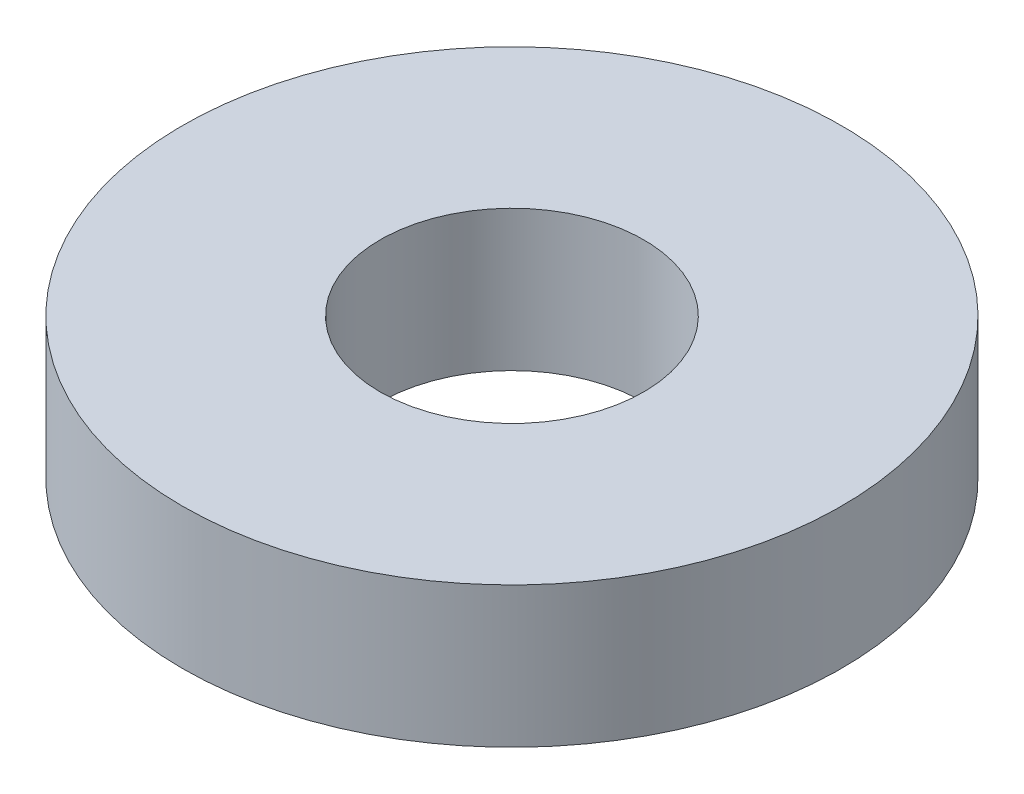
from build123d import *

# Parameters (mm, degrees)
SKETCH1_R           = 37.5
BOSS_EXTRUDE1_DEPTH = 16
SKETCH2_R           = 15
CUT_EXTRUDE1_DEPTH  = 56.394043001


with BuildPart() as part:
    # Sketch1 → Boss-Extrude1 (new body)
    with BuildSketch(Plane(origin=(0, 0, 0), x_dir=(1, 0, 0), z_dir=(0, 1, 0))):
        Circle(SKETCH1_R)
    extrude(amount=BOSS_EXTRUDE1_DEPTH)

    # Sketch2 → Cut-Extrude1 (cut, through all)
    with BuildSketch(Plane(origin=(0, 0, 0), x_dir=(1, 0, 0), z_dir=(0, 1, 0))):
        Circle(SKETCH2_R)
    extrude(amount=CUT_EXTRUDE1_DEPTH, mode=Mode.SUBTRACT)


solid = part.part
